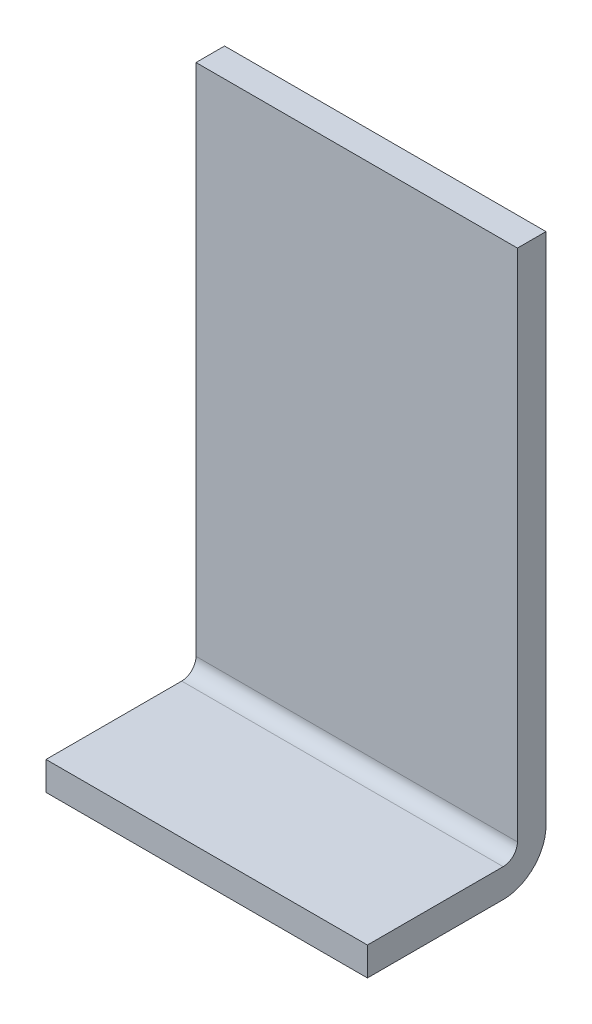
from build123d import *

# Parameters (mm, degrees)
SKETCH1_W           = 22.5
SKETCH1_H           = 12.5
BOSS_EXTRUDE1_DEPTH = 2
SKETCH2_W           = 22.5
SKETCH2_H           = 37
BOSS_EXTRUDE2_DEPTH = 2
FILLET1_R           = 1
FILLET2_R           = 3


with BuildPart() as part:
    # Sketch1 → Boss-Extrude1 (new body)
    with BuildSketch(Plane(origin=(0, 0, 0), x_dir=(1, 0, 0), z_dir=(0, 1, 0))):
        with Locations((11.25, 6.25)):
            Rectangle(SKETCH1_W, SKETCH1_H)
    extrude(amount=BOSS_EXTRUDE1_DEPTH)

    # Sketch2 → Boss-Extrude2 (add)
    with BuildSketch(Plane(origin=(0, 0, -12.5), x_dir=(-1, 0, 0), z_dir=(0, 0, -1))):
        with Locations((-11.25, 20.5)):
            Rectangle(SKETCH2_W, SKETCH2_H)
    extrude(amount=-BOSS_EXTRUDE2_DEPTH)

    # Fillet1
    fillet1_edges = [part.edges().sort_by_distance(p)[0] for p in [
        (11.25, 2, -10.5),
    ]]
    fillet(fillet1_edges, radius=FILLET1_R)

    # Fillet2
    fillet2_edges = [part.edges().sort_by_distance(p)[0] for p in [
        (11.25, 0, -12.5),
    ]]
    fillet(fillet2_edges, radius=FILLET2_R)


solid = part.part
